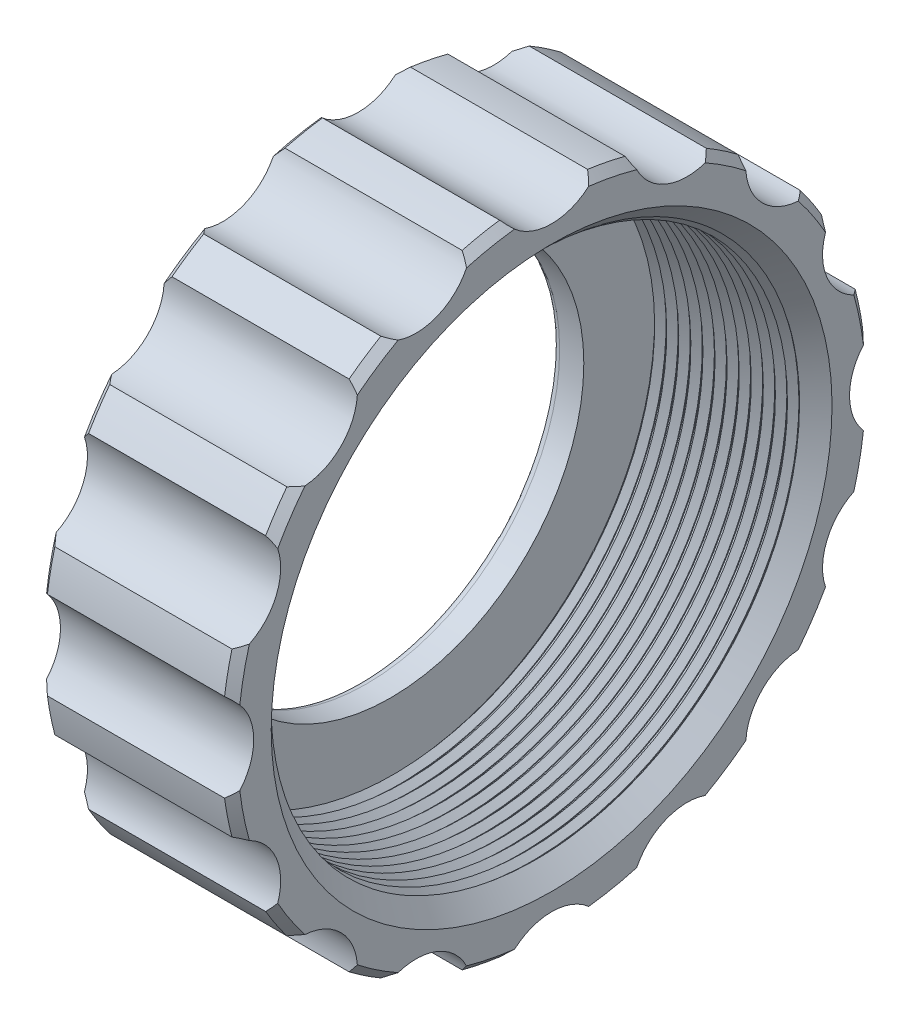
from build123d import *

# Parameters (mm, degrees)
CHAMFER1_SIZE      = 1
SKETCH2_R          = 7
CUT_EXTRUDE1_DEPTH = 62.449165983
CIRPATTERN1_COUNT  = 16
SWEEP1_PITCH       = 1.5
SWEEP1_HEIGHT      = 20
SWEEP1_RADIUS      = 33
FILLET1_R          = 1


with BuildPart() as part:
    # Sketch1 → Revolve1 (revolve)
    with BuildSketch(Plane.XY, mode=Mode.PRIVATE) as revolve1_sk:
        Polygon((0, 24), (0, 40), (24, 40), (24, 33), (4, 33), (4, 24), align=None)
    revolve(revolve1_sk.sketch.rotate(Axis((0, 0, 0), (1, 0, 0)), 90), axis=Axis((0, 0, 0), (1, 0, 0)))

    # Chamfer1
    chamfer1_edges = [part.edges().sort_by_distance(p)[0] for p in [
        (24, 0, -40),
        (0, 0, -40),
    ]]
    chamfer(chamfer1_edges, length=CHAMFER1_SIZE)

    # Sketch2 → Cut-Extrude1 (cut, through all)
    with BuildSketch(Plane.ZY):
        with Locations((0, 44)):
            Circle(SKETCH2_R)
    cut_extrude1 = extrude(amount=-CUT_EXTRUDE1_DEPTH, mode=Mode.SUBTRACT)

    # CirPattern1: Cut-Extrude1 ×16 about axis
    cirpattern1_axis = Axis((0, 0, 0), (1, 0, 0))
    for i in range(1, CIRPATTERN1_COUNT):
        add(cut_extrude1.rotate(cirpattern1_axis, i * 360 / CIRPATTERN1_COUNT), mode=Mode.SUBTRACT)

    # Sweep1: sweep along a helix
    with BuildLine() as sweep1_path:
        Helix(SWEEP1_PITCH, SWEEP1_HEIGHT, SWEEP1_RADIUS, center=(24, 0, 0), direction=(-1, 0, 0))
    # Sketch4 → Sweep1 (sweep)
    with BuildSketch(Plane(origin=(0, 0, 0), x_dir=(1, 0, 0), z_dir=(0, 1, 0))):
        Polygon((24, 32.292893219), (24.707106781, 33), (24, 33.707106781), (23.292893219, 33), align=None)
    sweep(path=sweep1_path.line, is_frenet=True)

    # Sketch5 → Cut-Revolve1 (revolve, cut)
    with BuildSketch(Plane.XY, mode=Mode.PRIVATE) as cut_revolve1_sk:
        Polygon((21.171572875, -32), (24, -34.828427125), (26.828427125, -32), (24, -29.171572875), align=None)
    revolve(cut_revolve1_sk.sketch.rotate(Axis((0, 0, 0), (1, 0, 0)), 180.928425104), axis=Axis((0, 0, 0), (1, 0, 0)), mode=Mode.SUBTRACT)

    # Fillet1
    fillet1_edges = [part.edges().sort_by_distance(p)[0] for p in [
        (0, 0, -24),
    ]]
    fillet(fillet1_edges, radius=FILLET1_R)


solid = part.part
